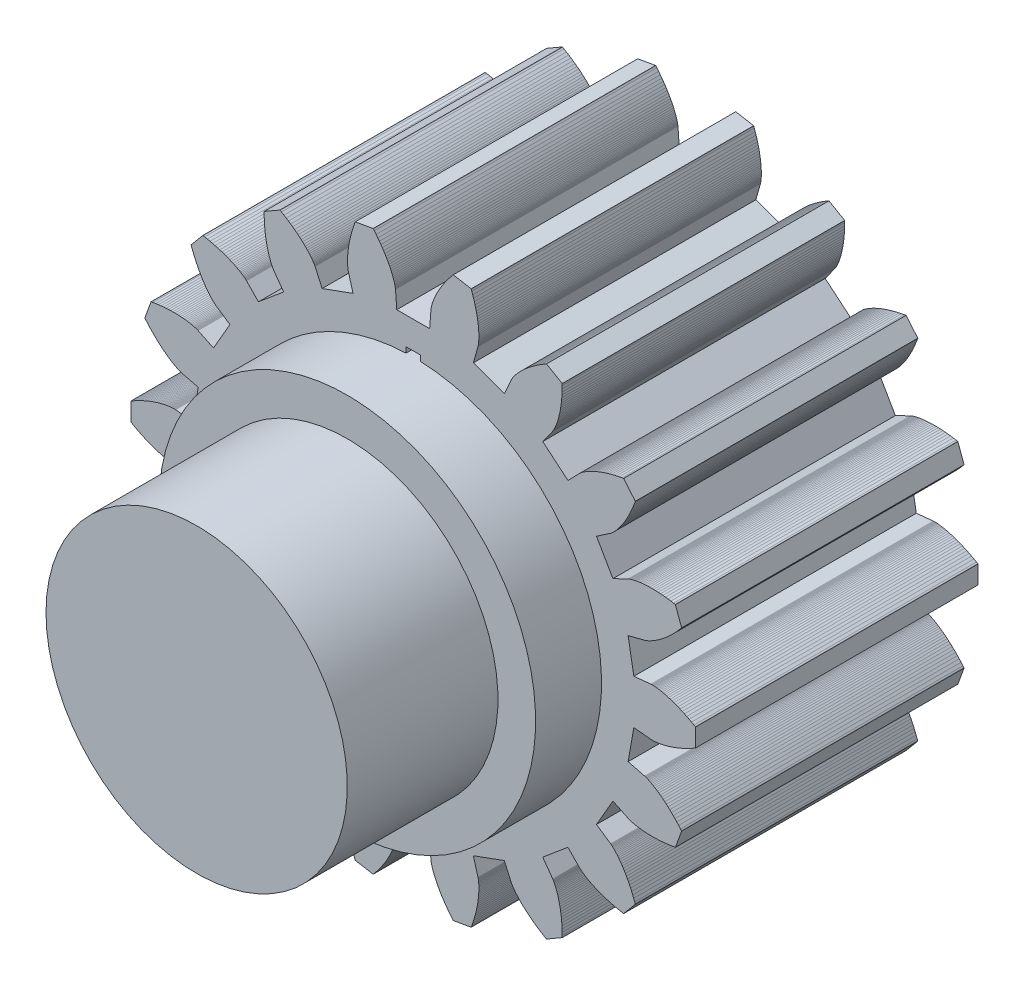
from build123d import *

# Parameters (mm, degrees)
EX_SUN_GEAR_PROFILE_DEPTH = 7.5
SKETCH1_W                 = 0.758517846
SKETCH1_H                 = 2.788377582
CUT_EXTRUDE1_DEPTH        = 1


with BuildPart() as part:
    # SK_Sun_Gear_Profile_DXF → EX_Sun_Gear_Profile (new, symmetric)
    with BuildSketch(Plane.XY):
        Polygon((11.715844, -1.1788231), (12.624043, -1.2701816), (12.6307047, -1.2706619), (12.6421382, -1.2712692), (12.6583493, -1.2718184), (12.6793382, -1.2721246), (12.7050997, -1.2720025), (12.7356234, -1.2712672), (12.7708933, -1.2697341), (12.8108882, -1.2672187), (12.8555814, -1.2635374), (12.9049411, -1.2585073), (12.9589299, -1.2519461), (13.0175052, -1.2436725), (13.0806192, -1.2335066), (13.1482187, -1.2212695), (13.2202453, -1.2067837), (13.2966355, -1.1898733), (13.3773206, -1.1703639), (13.4622268, -1.1480831), (13.5512752, -1.1228603), (13.6443819, -1.0945269), (13.7414581, -1.0629166), (13.84241, -1.0278654), (13.9471389, -0.9892116), (14.0555414, -0.9467962), (14.1675093, -0.9004628), (14.2829298, -0.850058), (14.4016854, -0.795431), (14.5236543, -0.7364343), (14.6487099, -0.6729237), (14.7767214, -0.6047579), (14.9075538, -0.5317993), (14.9739844, -0.4934806), (14.9906948, -0.4837065), (14.9917405, -0.483093), (14.9922286, 0.4827851), (14.9906948, 0.4837065), (14.9739844, 0.4934806), (14.9075538, 0.5317993), (14.7767214, 0.6047579), (14.6487099, 0.6729237), (14.5236543, 0.7364343), (14.4016854, 0.795431), (14.2829298, 0.850058), (14.1675093, 0.9004628), (14.0555414, 0.9467962), (13.9471389, 0.9892116), (13.84241, 1.0278654), (13.7414581, 1.0629166), (13.6443819, 1.0945269), (13.5512752, 1.1228603), (13.4622268, 1.1480831), (13.3773206, 1.1703639), (13.2966355, 1.1898733), (13.2202453, 1.2067837), (13.1482187, 1.2212695), (13.0806192, 1.2335066), (13.0175052, 1.2436725), (12.9589299, 1.2519461), (12.9049411, 1.2585073), (12.8555814, 1.2635374), (12.8108882, 1.2672187), (12.7708933, 1.2697341), (12.7356234, 1.2712672), (12.7050997, 1.2720025), (12.6793382, 1.2721246), (12.6583493, 1.2718184), (12.6421382, 1.2712692), (12.6307047, 1.2706619), (12.624043, 1.2701816), (11.715844, 1.1788231), (11.4124734, 2.8993233), (12.2971477, 3.1240968), (12.3035719, 3.1259238), (12.3145237, 3.1292637), (12.329945, 3.134292), (12.3497728, 3.141183), (12.3739389, 3.1501086), (12.4023703, 3.1612393), (12.4349888, 3.174743), (12.4717114, 3.1907858), (12.5124503, 3.209531), (12.5571128, 3.2311398), (12.6056016, 3.2557706), (12.6578147, 3.2835791), (12.7136455, 3.3147182), (12.7729828, 3.3493377), (12.8357113, 3.3875844), (12.9017109, 3.429602), (12.9708575, 3.4755308), (13.0430227, 3.5255075), (13.1180742, 3.5796656), (13.1958753, 3.6381346), (13.2762857, 3.7010406), (13.3591612, 3.7685055), (13.4443538, 3.8406476), (13.5317119, 3.9175809), (13.6210804, 3.9994153), (13.7123007, 4.0862565), (13.805211, 4.1782059), (13.8996461, 4.2753604), (13.995438, 4.3778124), (14.0924154, 4.4856499), (14.1904043, 4.5989559), (14.239723, 4.6576842), (14.2520826, 4.6725841), (14.2528555, 4.6735183), (13.9229644, 5.5813137), (13.9212079, 5.581655), (13.9021624, 5.5851244), (13.8266322, 5.5984115), (13.6787367, 5.6222229), (13.5351311, 5.6424952), (13.3958954, 5.6594042), (13.2611041, 5.6731271), (13.1308268, 5.6838429), (13.0051275, 5.6917318), (12.8840651, 5.6969757), (12.7676932, 5.6997573), (12.6560598, 5.7002606), (12.5492079, 5.6986704), (12.4471748, 5.6951723), (12.3499925, 5.6899526), (12.2576876, 5.683198), (12.1702814, 5.6750954), (12.0877896, 5.6658323), (12.0102226, 5.6555959), (11.9375853, 5.6445736), (11.8698772, 5.6329523), (11.8070926, 5.6209189), (11.7492201, 5.6086595), (11.6962431, 5.5963598), (11.6481398, 5.5842046), (11.6048828, 5.5723779), (11.5664396, 5.5610625), (11.5327723, 5.5504402), (11.503838, 5.5406914), (11.4795883, 5.5319952), (11.4599699, 5.5245289), (11.4449244, 5.5184682), (11.434388, 5.513987), (11.4282924, 5.5112572), (10.6061109, 5.114786), (9.7325901, 6.6277685), (10.4870349, 7.1415629), (10.4924468, 7.145477), (10.5015958, 7.1523611), (10.5143673, 7.1623607), (10.5306425, 7.1756175), (10.5502985, 7.1922702), (10.5732084, 7.2124537), (10.5992411, 7.2362992), (10.6282622, 7.2639344), (10.6601329, 7.2954826), (10.6947113, 7.3310637), (10.7318517, 7.3707933), (10.7714049, 7.4147826), (10.8132184, 7.463139), (10.8571368, 7.5159653), (10.9030011, 7.5733599), (10.9506495, 7.6354167), (10.9999175, 7.7022252), (11.0506376, 7.7738699), (11.1026398, 7.8504309), (11.1557513, 7.9319834), (11.2097973, 8.0185976), (11.2646004, 8.1103391), (11.3199812, 8.207268), (11.3757582, 8.3094399), (11.4317481, 8.4169049), (11.4877657, 8.5297081), (11.5436243, 8.6478895), (11.5991355, 8.7714836), (11.6541098, 8.9005198), (11.7083562, 9.035022), (11.7616827, 9.175009), (11.7879408, 9.2470636), (11.794459, 9.2652922), (11.7948657, 9.2664343), (11.1743852, 10.0066536), (11.1726179, 10.0063736), (11.1535344, 10.0031197), (11.0780148, 9.9897727), (10.9308945, 9.9615648), (10.7890158, 9.9314986), (10.6523938, 9.8997665), (10.5210379, 9.8665604), (10.3949523, 9.8320725), (10.2741354, 9.796494), (10.1585805, 9.7600158), (10.0482753, 9.7228281), (9.9432021, 9.6851202), (9.843338, 9.6470804), (9.7486546, 9.6088959), (9.6591184, 9.5707527), (9.5746904, 9.5328353), (9.4953267, 9.4953267), (9.4209779, 9.4584083), (9.3515898, 9.4222598), (9.2871029, 9.3870588), (9.2274529, 9.3529809), (9.1725703, 9.3201995), (9.1223808, 9.2888859), (9.0768056, 9.2592088), (9.0357605, 9.2313343), (8.9991572, 9.205426), (8.9669025, 9.1816447), (8.9388987, 9.1601481), (8.9150436, 9.1410912), (8.8952306, 9.1246255), (8.879349, 9.1108996), (8.8672837, 9.1000585), (8.8589154, 9.0922439), (8.854121, 9.0875939), (8.2171243, 8.4338303), (6.8788128, 9.556807), (7.412031, 10.2976511), (7.4157778, 10.3031802), (7.4220205, 10.3127783), (7.4306018, 10.3265429), (7.4413613, 10.3445667), (7.4541364, 10.3669379), (7.4687614, 10.3937398), (7.4850686, 10.425051), (7.5028877, 10.4609453), (7.5220462, 10.5014914), (7.5423698, 10.5467532), (7.563682, 10.5967895), (7.5858046, 10.651654), (7.6085577, 10.7113952), (7.6317598, 10.7760566), (7.655228, 10.8456764), (7.6787782, 10.9202875), (7.7022252, 10.9999175), (7.7253825, 11.0845888), (7.7480631, 11.1743184), (7.7700791, 11.2691179), (7.7912419, 11.3689935), (7.8113625, 11.473946), (7.8302518, 11.5839708), (7.8477202, 11.6990578), (7.8635783, 11.8191915), (7.8776367, 11.9443511), (7.8897062, 12.07451), (7.899598, 12.2096364), (7.9071239, 12.349693), (7.9120964, 12.4946372), (7.9143286, 12.6444207), (7.9143589, 12.7211106), (7.9142495, 12.7404692), (7.9142411, 12.7416816), (7.0780102, 13.2250434), (7.0764453, 13.2241758), (7.0596255, 13.2145912), (6.9932252, 13.1762199), (6.864625, 13.099395), (6.7415859, 13.0226167), (6.6240563, 12.9460707), (6.5119793, 12.8699409), (6.4052931, 12.794409), (6.303931, 12.7196544), (6.2078211, 12.645854), (6.1168871, 12.5731824), (6.0310474, 12.5018114), (5.9502163, 12.4319101), (5.8743029, 12.3636448), (5.8032121, 12.2971787), (5.7368443, 12.232672), (5.6750954, 12.1702814), (5.6178573, 12.1101608), (5.5650173, 12.0524601), (5.5164589, 11.9973261), (5.4720615, 11.9449019), (5.4317006, 11.8953265), (5.3952479, 11.8487355), (5.3625713, 11.8052605), (5.3335352, 11.7650288), (5.3080005, 11.728164), (5.2858247, 11.694785), (5.266862, 11.665007), (5.2509634, 11.6389404), (5.2379769, 11.6166913), (5.2277476, 11.5983613), (5.2201177, 11.5840475), (5.2149269, 11.573842), (5.212012, 11.5678327), (4.8370312, 10.7356301), (3.1953491, 11.3331535), (3.4430267, 12.2116907), (3.4446565, 12.2181678), (3.44724, 12.2293222), (3.450596, 12.2451916), (3.4545422, 12.2658085), (3.4588954, 12.2911998), (3.4634716, 12.3213874), (3.4680863, 12.3563877), (3.4725542, 12.3962118), (3.4766898, 12.4408653), (3.4803072, 12.4903486), (3.4832207, 12.5446565), (3.4852444, 12.6037786), (3.4861926, 12.667699), (3.4858799, 12.7363965), (3.4841215, 12.8098443), (3.4807329, 12.8880104), (3.4755308, 12.9708575), (3.4683323, 13.0583428), (3.4589558, 13.1504183), (3.4472206, 13.2470305), (3.4329477, 13.348121), (3.4159591, 13.4536257), (3.3960785, 13.5634757), (3.3731314, 13.6775967), (3.3469449, 13.7959093), (3.3173484, 13.918329), (3.284173, 14.0447663), (3.2472523, 14.1751269), (3.2064222, 14.3093111), (3.161521, 14.4472147), (3.1123896, 14.5887286), (3.0861886, 14.660804), (3.0794648, 14.6789577), (3.0790422, 14.6800941), (2.1279227, 14.8482977), (2.1267489, 14.8469472), (2.1142216, 14.832188), (2.0649495, 14.7734205), (1.9703805, 14.6572449), (1.8810213, 14.543015), (1.7967599, 14.4308878), (1.7174798, 14.3210166), (1.6430611, 14.213551), (1.5733794, 14.1086367), (1.5083069, 14.0064155), (1.447712, 13.9070253), (1.3914595, 13.8105996), (1.3394106, 13.717268), (1.2914235, 13.6271557), (1.2473527, 13.5403835), (1.20705, 13.4570679), (1.1703639, 13.3773206), (1.1371401, 13.301249), (1.1072215, 13.2289558), (1.0804485, 13.1605389), (1.0566588, 13.0960914), (1.0356877, 13.0357016), (1.0173684, 12.9794528), (1.0015318, 12.9274236), (0.9880068, 12.8796873), (0.9766206, 12.8363122), (0.9671984, 12.7973617), (0.959564, 12.7628939), (0.9535395, 12.7329616), (0.9489458, 12.7076127), (0.9456026, 12.6868895), (0.9433285, 12.6708293), (0.9419412, 12.659464), (0.9412574, 12.6528201), (0.8735208, 11.7425545), (-0.8735208, 11.7425545), (-0.9412574, 12.6528201), (-0.9419412, 12.659464), (-0.9433285, 12.6708293), (-0.9456026, 12.6868895), (-0.9489458, 12.7076127), (-0.9535395, 12.7329616), (-0.959564, 12.7628939), (-0.9671984, 12.7973617), (-0.9766206, 12.8363122), (-0.9880068, 12.8796873), (-1.0015318, 12.9274236), (-1.0173684, 12.9794528), (-1.0356877, 13.0357016), (-1.0566588, 13.0960914), (-1.0804485, 13.1605389), (-1.1072215, 13.2289558), (-1.1371401, 13.301249), (-1.1703639, 13.3773206), (-1.20705, 13.4570679), (-1.2473527, 13.5403835), (-1.2914235, 13.6271557), (-1.3394106, 13.717268), (-1.3914595, 13.8105996), (-1.447712, 13.9070253), (-1.5083069, 14.0064155), (-1.5733794, 14.1086367), (-1.6430611, 14.213551), (-1.7174798, 14.3210166), (-1.7967599, 14.4308878), (-1.8810213, 14.543015), (-1.9703805, 14.6572449), (-2.0649495, 14.7734205), (-2.1142216, 14.832188), (-2.1267489, 14.8469472), (-2.1275347, 14.8478705), (-3.0788237, 14.6806282), (-3.0794648, 14.6789577), (-3.0861886, 14.660804), (-3.1123896, 14.5887286), (-3.161521, 14.4472147), (-3.2064222, 14.3093111), (-3.2472523, 14.1751269), (-3.284173, 14.0447663), (-3.3173484, 13.918329), (-3.3469449, 13.7959093), (-3.3731314, 13.6775967), (-3.3960785, 13.5634757), (-3.4159591, 13.4536257), (-3.4329477, 13.348121), (-3.4472206, 13.2470305), (-3.4589558, 13.1504183), (-3.4683323, 13.0583428), (-3.4755308, 12.9708575), (-3.4807329, 12.8880104), (-3.4841215, 12.8098443), (-3.4858799, 12.7363965), (-3.4861926, 12.667699), (-3.4852444, 12.6037786), (-3.4832207, 12.5446565), (-3.4803072, 12.4903486), (-3.4766898, 12.4408653), (-3.4725542, 12.3962118), (-3.4680863, 12.3563877), (-3.4634716, 12.3213874), (-3.4588954, 12.2911998), (-3.4545422, 12.2658085), (-3.450596, 12.2451916), (-3.44724, 12.2293222), (-3.4446565, 12.2181678), (-3.4430267, 12.2116907), (-3.1953491, 11.3331535), (-4.8370312, 10.7356301), (-5.212012, 11.5678327), (-5.2149269, 11.573842), (-5.2201177, 11.5840475), (-5.2277476, 11.5983613), (-5.2379769, 11.6166913), (-5.2509634, 11.6389404), (-5.266862, 11.665007), (-5.2858247, 11.694785), (-5.3080005, 11.728164), (-5.3335352, 11.7650288), (-5.3625713, 11.8052605), (-5.3952479, 11.8487355), (-5.4317006, 11.8953265), (-5.4720615, 11.9449019), (-5.5164589, 11.9973261), (-5.5650173, 12.0524601), (-5.6178573, 12.1101608), (-5.6750954, 12.1702814), (-5.7368443, 12.232672), (-5.8032121, 12.2971787), (-5.8743029, 12.3636448), (-5.9502163, 12.4319101), (-6.0310474, 12.5018114), (-6.1168871, 12.5731824), (-6.2078211, 12.645854), (-6.303931, 12.7196544), (-6.4052931, 12.794409), (-6.5119793, 12.8699409), (-6.6240563, 12.9460707), (-6.7415859, 13.0226167), (-6.864625, 13.099395), (-6.9932252, 13.1762199), (-7.0596255, 13.2145912), (-7.0764453, 13.2241758), (-7.0774994, 13.2247747), (-7.9142184, 12.7422583), (-7.9142495, 12.7404692), (-7.9143589, 12.7211106), (-7.9143286, 12.6444207), (-7.9120964, 12.4946372), (-7.9071239, 12.349693), (-7.899598, 12.2096364), (-7.8897062, 12.07451), (-7.8776367, 11.9443511), (-7.8635783, 11.8191915), (-7.8477202, 11.6990578), (-7.8302518, 11.5839708), (-7.8113625, 11.473946), (-7.7912419, 11.3689935), (-7.7700791, 11.2691179), (-7.7480631, 11.1743184), (-7.7253825, 11.0845888), (-7.7022252, 10.9999175), (-7.6787782, 10.9202875), (-7.655228, 10.8456764), (-7.6317598, 10.7760566), (-7.6085577, 10.7113952), (-7.5858046, 10.651654), (-7.563682, 10.5967895), (-7.5423698, 10.5467532), (-7.5220462, 10.5014914), (-7.5028877, 10.4609453), (-7.4850686, 10.425051), (-7.4687614, 10.3937398), (-7.4541364, 10.3669379), (-7.4413613, 10.3445667), (-7.4306018, 10.3265429), (-7.4220205, 10.3127783), (-7.4157778, 10.3031802), (-7.412031, 10.2976511), (-6.8788128, 9.556807), (-8.2171243, 8.4338303), (-8.854121, 9.0875939), (-8.8589154, 9.0922439), (-8.8672837, 9.1000585), (-8.879349, 9.1108996), (-8.8952306, 9.1246255), (-8.9150436, 9.1410912), (-8.9388987, 9.1601481), (-8.9669025, 9.1816447), (-8.9991572, 9.205426), (-9.0357605, 9.2313343), (-9.0768056, 9.2592088), (-9.1223808, 9.2888859), (-9.1725703, 9.3201995), (-9.2274529, 9.3529809), (-9.2871029, 9.3870588), (-9.3515898, 9.4222598), (-9.4209779, 9.4584083), (-9.4953267, 9.4953267), (-9.5746904, 9.5328353), (-9.6591184, 9.5707527), (-9.7486546, 9.6088959), (-9.843338, 9.6470804), (-9.9432021, 9.6851202), (-10.0482753, 9.7228281), (-10.1585805, 9.7600158), (-10.2741354, 9.796494), (-10.3949523, 9.8320725), (-10.5210379, 9.8665604), (-10.6523938, 9.8997665), (-10.7890158, 9.9314986), (-10.9308945, 9.9615648), (-11.0780148, 9.9897727), (-11.1535344, 10.0031197), (-11.1726179, 10.0063736), (-11.1738133, 10.0065758), (-11.7950417, 9.266984), (-11.794459, 9.2652922), (-11.7879408, 9.2470636), (-11.7616827, 9.175009), (-11.7083562, 9.035022), (-11.6541098, 8.9005198), (-11.5991355, 8.7714836), (-11.5436243, 8.6478895), (-11.4877657, 8.5297081), (-11.4317481, 8.4169049), (-11.3757582, 8.3094399), (-11.3199812, 8.207268), (-11.2646004, 8.1103391), (-11.2097973, 8.0185976), (-11.1557513, 7.9319834), (-11.1026398, 7.8504309), (-11.0506376, 7.7738699), (-10.9999175, 7.7022252), (-10.9506495, 7.6354167), (-10.9030011, 7.5733599), (-10.8571368, 7.5159653), (-10.8132184, 7.463139), (-10.7714049, 7.4147826), (-10.7318517, 7.3707933), (-10.6947113, 7.3310637), (-10.6601329, 7.2954826), (-10.6282622, 7.2639344), (-10.5992411, 7.2362992), (-10.5732084, 7.2124537), (-10.5502985, 7.1922702), (-10.5306425, 7.1756175), (-10.5143673, 7.1623607), (-10.5015958, 7.1523611), (-10.4924468, 7.145477), (-10.4870349, 7.1415629), (-9.7325901, 6.6277685), (-10.6061109, 5.114786), (-11.4282924, 5.5112572), (-11.434388, 5.513987), (-11.4449244, 5.5184682), (-11.4599699, 5.5245289), (-11.4795883, 5.5319952), (-11.503838, 5.5406914), (-11.5327723, 5.5504402), (-11.5664396, 5.5610625), (-11.6048828, 5.5723779), (-11.6481398, 5.5842046), (-11.6962431, 5.5963598), (-11.7492201, 5.6086595), (-11.8070926, 5.6209189), (-11.8698772, 5.6329523), (-11.9375853, 5.6445736), (-12.0102226, 5.6555959), (-12.0877896, 5.6658323), (-12.1702814, 5.6750954), (-12.2576876, 5.683198), (-12.3499925, 5.6899526), (-12.4471748, 5.6951723), (-12.5492079, 5.6986704), (-12.6560598, 5.7002606), (-12.7676932, 5.6997573), (-12.8840651, 5.6969757), (-13.0051275, 5.6917318), (-13.1308268, 5.6838429), (-13.2611041, 5.6731271), (-13.3958954, 5.6594042), (-13.5351311, 5.6424952), (-13.6787367, 5.6222229), (-13.8266322, 5.5984115), (-13.9021624, 5.5851244), (-13.9212079, 5.581655), (-13.9224004, 5.5814362), (-14.2532088, 4.6739746), (-14.2520826, 4.6725841), (-14.239723, 4.6576842), (-14.1904043, 4.5989559), (-14.0924154, 4.4856499), (-13.995438, 4.3778124), (-13.8996461, 4.2753604), (-13.805211, 4.1782059), (-13.7123007, 4.0862565), (-13.6210804, 3.9994153), (-13.5317119, 3.9175809), (-13.4443538, 3.8406476), (-13.3591612, 3.7685055), (-13.2762857, 3.7010406), (-13.1958753, 3.6381346), (-13.1180742, 3.5796656), (-13.0430227, 3.5255075), (-12.9708575, 3.4755308), (-12.9017109, 3.429602), (-12.8357113, 3.3875844), (-12.7729828, 3.3493377), (-12.7136455, 3.3147182), (-12.6578147, 3.2835791), (-12.6056016, 3.2557706), (-12.5571128, 3.2311398), (-12.5124503, 3.209531), (-12.4717114, 3.1907858), (-12.4349888, 3.174743), (-12.4023703, 3.1612393), (-12.3739389, 3.1501086), (-12.3497728, 3.141183), (-12.329945, 3.134292), (-12.3145237, 3.1292637), (-12.3035719, 3.1259238), (-12.2971477, 3.1240968), (-11.4124734, 2.8993233), (-11.715844, 1.1788231), (-12.624043, 1.2701816), (-12.6307047, 1.2706619), (-12.6421382, 1.2712692), (-12.6583493, 1.2718184), (-12.6793382, 1.2721246), (-12.7050997, 1.2720025), (-12.7356234, 1.2712672), (-12.7708933, 1.2697341), (-12.8108882, 1.2672187), (-12.8555814, 1.2635374), (-12.9049411, 1.2585073), (-12.9589299, 1.2519461), (-13.0175052, 1.2436725), (-13.0806192, 1.2335066), (-13.1482187, 1.2212695), (-13.2202453, 1.2067837), (-13.2966355, 1.1898733), (-13.3773206, 1.1703639), (-13.4622268, 1.1480831), (-13.5512752, 1.1228603), (-13.6443819, 1.0945269), (-13.7414581, 1.0629166), (-13.84241, 1.0278654), (-13.9471389, 0.9892116), (-14.0555414, 0.9467962), (-14.1675093, 0.9004628), (-14.2829298, 0.850058), (-14.4016854, 0.795431), (-14.5236543, 0.7364343), (-14.6487099, 0.6729237), (-14.7767214, 0.6047579), (-14.9075538, 0.5317993), (-14.9739844, 0.4934806), (-14.9906948, 0.4837065), (-14.9917405, 0.483093), (-14.9922286, -0.4827851), (-14.9906948, -0.4837065), (-14.9739844, -0.4934806), (-14.9075538, -0.5317993), (-14.7767214, -0.6047579), (-14.6487099, -0.6729237), (-14.5236543, -0.7364343), (-14.4016854, -0.795431), (-14.2829298, -0.850058), (-14.1675093, -0.9004628), (-14.0555414, -0.9467962), (-13.9471389, -0.9892116), (-13.84241, -1.0278654), (-13.7414581, -1.0629166), (-13.6443819, -1.0945269), (-13.5512752, -1.1228603), (-13.4622268, -1.1480831), (-13.3773206, -1.1703639), (-13.2966355, -1.1898733), (-13.2202453, -1.2067837), (-13.1482187, -1.2212695), (-13.0806192, -1.2335066), (-13.0175052, -1.2436725), (-12.9589299, -1.2519461), (-12.9049411, -1.2585073), (-12.8555814, -1.2635374), (-12.8108882, -1.2672187), (-12.7708933, -1.2697341), (-12.7356234, -1.2712672), (-12.7050997, -1.2720025), (-12.6793382, -1.2721246), (-12.6583493, -1.2718184), (-12.6421382, -1.2712692), (-12.6307047, -1.2706619), (-12.624043, -1.2701816), (-11.715844, -1.1788231), (-11.4124734, -2.8993233), (-12.2971477, -3.1240968), (-12.3035719, -3.1259238), (-12.3145237, -3.1292637), (-12.329945, -3.134292), (-12.3497728, -3.141183), (-12.3739389, -3.1501086), (-12.4023703, -3.1612393), (-12.4349888, -3.174743), (-12.4717114, -3.1907858), (-12.5124503, -3.209531), (-12.5571128, -3.2311398), (-12.6056016, -3.2557706), (-12.6578147, -3.2835791), (-12.7136455, -3.3147182), (-12.7729828, -3.3493377), (-12.8357113, -3.3875844), (-12.9017109, -3.429602), (-12.9708575, -3.4755308), (-13.0430227, -3.5255075), (-13.1180742, -3.5796656), (-13.1958753, -3.6381346), (-13.2762857, -3.7010406), (-13.3591612, -3.7685055), (-13.4443538, -3.8406476), (-13.5317119, -3.9175809), (-13.6210804, -3.9994153), (-13.7123007, -4.0862565), (-13.805211, -4.1782059), (-13.8996461, -4.2753604), (-13.995438, -4.3778124), (-14.0924154, -4.4856499), (-14.1904043, -4.5989559), (-14.239723, -4.6576842), (-14.2520826, -4.6725841), (-14.2528555, -4.6735183), (-13.9229644, -5.5813137), (-13.9212079, -5.581655), (-13.9021624, -5.5851244), (-13.8266322, -5.5984115), (-13.6787367, -5.6222229), (-13.5351311, -5.6424952), (-13.3958954, -5.6594042), (-13.2611041, -5.6731271), (-13.1308268, -5.6838429), (-13.0051275, -5.6917318), (-12.8840651, -5.6969757), (-12.7676932, -5.6997573), (-12.6560598, -5.7002606), (-12.5492079, -5.6986704), (-12.4471748, -5.6951723), (-12.3499925, -5.6899526), (-12.2576876, -5.683198), (-12.1702814, -5.6750954), (-12.0877896, -5.6658323), (-12.0102226, -5.6555959), (-11.9375853, -5.6445736), (-11.8698772, -5.6329523), (-11.8070926, -5.6209189), (-11.7492201, -5.6086595), (-11.6962431, -5.5963598), (-11.6481398, -5.5842046), (-11.6048828, -5.5723779), (-11.5664396, -5.5610625), (-11.5327723, -5.5504402), (-11.503838, -5.5406914), (-11.4795883, -5.5319952), (-11.4599699, -5.5245289), (-11.4449244, -5.5184682), (-11.434388, -5.513987), (-11.4282924, -5.5112572), (-10.6061109, -5.114786), (-9.7325901, -6.6277685), (-10.4870349, -7.1415629), (-10.4924468, -7.145477), (-10.5015958, -7.1523611), (-10.5143673, -7.1623607), (-10.5306425, -7.1756175), (-10.5502985, -7.1922702), (-10.5732084, -7.2124537), (-10.5992411, -7.2362992), (-10.6282622, -7.2639344), (-10.6601329, -7.2954826), (-10.6947113, -7.3310637), (-10.7318517, -7.3707933), (-10.7714049, -7.4147826), (-10.8132184, -7.463139), (-10.8571368, -7.5159653), (-10.9030011, -7.5733599), (-10.9506495, -7.6354167), (-10.9999175, -7.7022252), (-11.0506376, -7.7738699), (-11.1026398, -7.8504309), (-11.1557513, -7.9319834), (-11.2097973, -8.0185976), (-11.2646004, -8.1103391), (-11.3199812, -8.207268), (-11.3757582, -8.3094399), (-11.4317481, -8.4169049), (-11.4877657, -8.5297081), (-11.5436243, -8.6478895), (-11.5991355, -8.7714836), (-11.6541098, -8.9005198), (-11.7083562, -9.035022), (-11.7616827, -9.175009), (-11.7879408, -9.2470636), (-11.794459, -9.2652922), (-11.7948657, -9.2664343), (-11.1743852, -10.0066536), (-11.1726179, -10.0063736), (-11.1535344, -10.0031197), (-11.0780148, -9.9897727), (-10.9308945, -9.9615648), (-10.7890158, -9.9314986), (-10.6523938, -9.8997665), (-10.5210379, -9.8665604), (-10.3949523, -9.8320725), (-10.2741354, -9.796494), (-10.1585805, -9.7600158), (-10.0482753, -9.7228281), (-9.9432021, -9.6851202), (-9.843338, -9.6470804), (-9.7486546, -9.6088959), (-9.6591184, -9.5707527), (-9.5746904, -9.5328353), (-9.4953267, -9.4953267), (-9.4209779, -9.4584083), (-9.3515898, -9.4222598), (-9.2871029, -9.3870588), (-9.2274529, -9.3529809), (-9.1725703, -9.3201995), (-9.1223808, -9.2888859), (-9.0768056, -9.2592088), (-9.0357605, -9.2313343), (-8.9991572, -9.205426), (-8.9669025, -9.1816447), (-8.9388987, -9.1601481), (-8.9150436, -9.1410912), (-8.8952306, -9.1246255), (-8.879349, -9.1108996), (-8.8672837, -9.1000585), (-8.8589154, -9.0922439), (-8.854121, -9.0875939), (-8.2171243, -8.4338303), (-6.8788128, -9.556807), (-7.412031, -10.2976511), (-7.4157778, -10.3031802), (-7.4220205, -10.3127783), (-7.4306018, -10.3265429), (-7.4413613, -10.3445667), (-7.4541364, -10.3669379), (-7.4687614, -10.3937398), (-7.4850686, -10.425051), (-7.5028877, -10.4609453), (-7.5220462, -10.5014914), (-7.5423698, -10.5467532), (-7.563682, -10.5967895), (-7.5858046, -10.651654), (-7.6085577, -10.7113952), (-7.6317598, -10.7760566), (-7.655228, -10.8456764), (-7.6787782, -10.9202875), (-7.7022252, -10.9999175), (-7.7253825, -11.0845888), (-7.7480631, -11.1743184), (-7.7700791, -11.2691179), (-7.7912419, -11.3689935), (-7.8113625, -11.473946), (-7.8302518, -11.5839708), (-7.8477202, -11.6990578), (-7.8635783, -11.8191915), (-7.8776367, -11.9443511), (-7.8897062, -12.07451), (-7.899598, -12.2096364), (-7.9071239, -12.349693), (-7.9120964, -12.4946372), (-7.9143286, -12.6444207), (-7.9143589, -12.7211106), (-7.9142495, -12.7404692), (-7.9142411, -12.7416816), (-7.0780102, -13.2250434), (-7.0764453, -13.2241758), (-7.0596255, -13.2145912), (-6.9932252, -13.1762199), (-6.864625, -13.099395), (-6.7415859, -13.0226167), (-6.6240563, -12.9460707), (-6.5119793, -12.8699409), (-6.4052931, -12.794409), (-6.303931, -12.7196544), (-6.2078211, -12.645854), (-6.1168871, -12.5731824), (-6.0310474, -12.5018114), (-5.9502163, -12.4319101), (-5.8743029, -12.3636448), (-5.8032121, -12.2971787), (-5.7368443, -12.232672), (-5.6750954, -12.1702814), (-5.6178573, -12.1101608), (-5.5650173, -12.0524601), (-5.5164589, -11.9973261), (-5.4720615, -11.9449019), (-5.4317006, -11.8953265), (-5.3952479, -11.8487355), (-5.3625713, -11.8052605), (-5.3335352, -11.7650288), (-5.3080005, -11.728164), (-5.2858247, -11.694785), (-5.266862, -11.665007), (-5.2509634, -11.6389404), (-5.2379769, -11.6166913), (-5.2277476, -11.5983613), (-5.2201177, -11.5840475), (-5.2149269, -11.573842), (-5.212012, -11.5678327), (-4.8370312, -10.7356301), (-3.1953491, -11.3331535), (-3.4430267, -12.2116907), (-3.4446565, -12.2181678), (-3.44724, -12.2293222), (-3.450596, -12.2451916), (-3.4545422, -12.2658085), (-3.4588954, -12.2911998), (-3.4634716, -12.3213874), (-3.4680863, -12.3563877), (-3.4725542, -12.3962118), (-3.4766898, -12.4408653), (-3.4803072, -12.4903486), (-3.4832207, -12.5446565), (-3.4852444, -12.6037786), (-3.4861926, -12.667699), (-3.4858799, -12.7363965), (-3.4841215, -12.8098443), (-3.4807329, -12.8880104), (-3.4755308, -12.9708575), (-3.4683323, -13.0583428), (-3.4589558, -13.1504183), (-3.4472206, -13.2470305), (-3.4329477, -13.348121), (-3.4159591, -13.4536257), (-3.3960785, -13.5634757), (-3.3731314, -13.6775967), (-3.3469449, -13.7959093), (-3.3173484, -13.918329), (-3.284173, -14.0447663), (-3.2472523, -14.1751269), (-3.2064222, -14.3093111), (-3.161521, -14.4472147), (-3.1123896, -14.5887286), (-3.0861886, -14.660804), (-3.0794648, -14.6789577), (-3.0790422, -14.6800941), (-2.1279227, -14.8482977), (-2.1267489, -14.8469472), (-2.1142216, -14.832188), (-2.0649495, -14.7734205), (-1.9703805, -14.6572449), (-1.8810213, -14.543015), (-1.7967599, -14.4308878), (-1.7174798, -14.3210166), (-1.6430611, -14.213551), (-1.5733794, -14.1086367), (-1.5083069, -14.0064155), (-1.447712, -13.9070253), (-1.3914595, -13.8105996), (-1.3394106, -13.717268), (-1.2914235, -13.6271557), (-1.2473527, -13.5403835), (-1.20705, -13.4570679), (-1.1703639, -13.3773206), (-1.1371401, -13.301249), (-1.1072215, -13.2289558), (-1.0804485, -13.1605389), (-1.0566588, -13.0960914), (-1.0356877, -13.0357016), (-1.0173684, -12.9794528), (-1.0015318, -12.9274236), (-0.9880068, -12.8796873), (-0.9766206, -12.8363122), (-0.9671984, -12.7973617), (-0.959564, -12.7628939), (-0.9535395, -12.7329616), (-0.9489458, -12.7076127), (-0.9456026, -12.6868895), (-0.9433285, -12.6708293), (-0.9419412, -12.659464), (-0.9412574, -12.6528201), (-0.8735208, -11.7425545), (0.8735208, -11.7425545), (0.9412574, -12.6528201), (0.9419412, -12.659464), (0.9433285, -12.6708293), (0.9456026, -12.6868895), (0.9489458, -12.7076127), (0.9535395, -12.7329616), (0.959564, -12.7628939), (0.9671984, -12.7973617), (0.9766206, -12.8363122), (0.9880068, -12.8796873), (1.0015318, -12.9274236), (1.0173684, -12.9794528), (1.0356877, -13.0357016), (1.0566588, -13.0960914), (1.0804485, -13.1605389), (1.1072215, -13.2289558), (1.1371401, -13.301249), (1.1703639, -13.3773206), (1.20705, -13.4570679), (1.2473527, -13.5403835), (1.2914235, -13.6271557), (1.3394106, -13.717268), (1.3914595, -13.8105996), (1.447712, -13.9070253), (1.5083069, -14.0064155), (1.5733794, -14.1086367), (1.6430611, -14.213551), (1.7174798, -14.3210166), (1.7967599, -14.4308878), (1.8810213, -14.543015), (1.9703805, -14.6572449), (2.0649495, -14.7734205), (2.1142216, -14.832188), (2.1267489, -14.8469472), (2.1275347, -14.8478705), (3.0788237, -14.6806282), (3.0794648, -14.6789577), (3.0861886, -14.660804), (3.1123896, -14.5887286), (3.161521, -14.4472147), (3.2064222, -14.3093111), (3.2472523, -14.1751269), (3.284173, -14.0447663), (3.3173484, -13.918329), (3.3469449, -13.7959093), (3.3731314, -13.6775967), (3.3960785, -13.5634757), (3.4159591, -13.4536257), (3.4329477, -13.348121), (3.4472206, -13.2470305), (3.4589558, -13.1504183), (3.4683323, -13.0583428), (3.4755308, -12.9708575), (3.4807329, -12.8880104), (3.4841215, -12.8098443), (3.4858799, -12.7363965), (3.4861926, -12.667699), (3.4852444, -12.6037786), (3.4832207, -12.5446565), (3.4803072, -12.4903486), (3.4766898, -12.4408653), (3.4725542, -12.3962118), (3.4680863, -12.3563877), (3.4634716, -12.3213874), (3.4588954, -12.2911998), (3.4545422, -12.2658085), (3.450596, -12.2451916), (3.44724, -12.2293222), (3.4446565, -12.2181678), (3.4430267, -12.2116907), (3.1953491, -11.3331535), (4.8370312, -10.7356301), (5.212012, -11.5678327), (5.2149269, -11.573842), (5.2201177, -11.5840475), (5.2277476, -11.5983613), (5.2379769, -11.6166913), (5.2509634, -11.6389404), (5.266862, -11.665007), (5.2858247, -11.694785), (5.3080005, -11.728164), (5.3335352, -11.7650288), (5.3625713, -11.8052605), (5.3952479, -11.8487355), (5.4317006, -11.8953265), (5.4720615, -11.9449019), (5.5164589, -11.9973261), (5.5650173, -12.0524601), (5.6178573, -12.1101608), (5.6750954, -12.1702814), (5.7368443, -12.232672), (5.8032121, -12.2971787), (5.8743029, -12.3636448), (5.9502163, -12.4319101), (6.0310474, -12.5018114), (6.1168871, -12.5731824), (6.2078211, -12.645854), (6.303931, -12.7196544), (6.4052931, -12.794409), (6.5119793, -12.8699409), (6.6240563, -12.9460707), (6.7415859, -13.0226167), (6.864625, -13.099395), (6.9932252, -13.1762199), (7.0596255, -13.2145912), (7.0764453, -13.2241758), (7.0774994, -13.2247747), (7.9142184, -12.7422583), (7.9142495, -12.7404692), (7.9143589, -12.7211106), (7.9143286, -12.6444207), (7.9120964, -12.4946372), (7.9071239, -12.349693), (7.899598, -12.2096364), (7.8897062, -12.07451), (7.8776367, -11.9443511), (7.8635783, -11.8191915), (7.8477202, -11.6990578), (7.8302518, -11.5839708), (7.8113625, -11.473946), (7.7912419, -11.3689935), (7.7700791, -11.2691179), (7.7480631, -11.1743184), (7.7253825, -11.0845888), (7.7022252, -10.9999175), (7.6787782, -10.9202875), (7.655228, -10.8456764), (7.6317598, -10.7760566), (7.6085577, -10.7113952), (7.5858046, -10.651654), (7.563682, -10.5967895), (7.5423698, -10.5467532), (7.5220462, -10.5014914), (7.5028877, -10.4609453), (7.4850686, -10.425051), (7.4687614, -10.3937398), (7.4541364, -10.3669379), (7.4413613, -10.3445667), (7.4306018, -10.3265429), (7.4220205, -10.3127783), (7.4157778, -10.3031802), (7.412031, -10.2976511), (6.8788128, -9.556807), (8.2171243, -8.4338303), (8.854121, -9.0875939), (8.8589154, -9.0922439), (8.8672837, -9.1000585), (8.879349, -9.1108996), (8.8952306, -9.1246255), (8.9150436, -9.1410912), (8.9388987, -9.1601481), (8.9669025, -9.1816447), (8.9991572, -9.205426), (9.0357605, -9.2313343), (9.0768056, -9.2592088), (9.1223808, -9.2888859), (9.1725703, -9.3201995), (9.2274529, -9.3529809), (9.2871029, -9.3870588), (9.3515898, -9.4222598), (9.4209779, -9.4584083), (9.4953267, -9.4953267), (9.5746904, -9.5328353), (9.6591184, -9.5707527), (9.7486546, -9.6088959), (9.843338, -9.6470804), (9.9432021, -9.6851202), (10.0482753, -9.7228281), (10.1585805, -9.7600158), (10.2741354, -9.796494), (10.3949523, -9.8320725), (10.5210379, -9.8665604), (10.6523938, -9.8997665), (10.7890158, -9.9314986), (10.9308945, -9.9615648), (11.0780148, -9.9897727), (11.1535344, -10.0031197), (11.1726179, -10.0063736), (11.1738133, -10.0065758), (11.7950417, -9.266984), (11.794459, -9.2652922), (11.7879408, -9.2470636), (11.7616827, -9.175009), (11.7083562, -9.035022), (11.6541098, -8.9005198), (11.5991355, -8.7714836), (11.5436243, -8.6478895), (11.4877657, -8.5297081), (11.4317481, -8.4169049), (11.3757582, -8.3094399), (11.3199812, -8.207268), (11.2646004, -8.1103391), (11.2097973, -8.0185976), (11.1557513, -7.9319834), (11.1026398, -7.8504309), (11.0506376, -7.7738699), (10.9999175, -7.7022252), (10.9506495, -7.6354167), (10.9030011, -7.5733599), (10.8571368, -7.5159653), (10.8132184, -7.463139), (10.7714049, -7.4147826), (10.7318517, -7.3707933), (10.6947113, -7.3310637), (10.6601329, -7.2954826), (10.6282622, -7.2639344), (10.5992411, -7.2362992), (10.5732084, -7.2124537), (10.5502985, -7.1922702), (10.5306425, -7.1756175), (10.5143673, -7.1623607), (10.5015958, -7.1523611), (10.4924468, -7.145477), (10.4870349, -7.1415629), (9.7325901, -6.6277685), (10.6061109, -5.114786), (11.4282924, -5.5112572), (11.434388, -5.513987), (11.4449244, -5.5184682), (11.4599699, -5.5245289), (11.4795883, -5.5319952), (11.503838, -5.5406914), (11.5327723, -5.5504402), (11.5664396, -5.5610625), (11.6048828, -5.5723779), (11.6481398, -5.5842046), (11.6962431, -5.5963598), (11.7492201, -5.6086595), (11.8070926, -5.6209189), (11.8698772, -5.6329523), (11.9375853, -5.6445736), (12.0102226, -5.6555959), (12.0877896, -5.6658323), (12.1702814, -5.6750954), (12.2576876, -5.683198), (12.3499925, -5.6899526), (12.4471748, -5.6951723), (12.5492079, -5.6986704), (12.6560598, -5.7002606), (12.7676932, -5.6997573), (12.8840651, -5.6969757), (13.0051275, -5.6917318), (13.1308268, -5.6838429), (13.2611041, -5.6731271), (13.3958954, -5.6594042), (13.5351311, -5.6424952), (13.6787367, -5.6222229), (13.8266322, -5.5984115), (13.9021624, -5.5851244), (13.9212079, -5.581655), (13.9224004, -5.5814362), (14.2532088, -4.6739746), (14.2520826, -4.6725841), (14.239723, -4.6576842), (14.1904043, -4.5989559), (14.0924154, -4.4856499), (13.995438, -4.3778124), (13.8996461, -4.2753604), (13.805211, -4.1782059), (13.7123007, -4.0862565), (13.6210804, -3.9994153), (13.5317119, -3.9175809), (13.4443538, -3.8406476), (13.3591612, -3.7685055), (13.2762857, -3.7010406), (13.1958753, -3.6381346), (13.1180742, -3.5796656), (13.0430227, -3.5255075), (12.9708575, -3.4755308), (12.9017109, -3.429602), (12.8357113, -3.3875844), (12.7729828, -3.3493377), (12.7136455, -3.3147182), (12.6578147, -3.2835791), (12.6056016, -3.2557706), (12.5571128, -3.2311398), (12.5124503, -3.209531), (12.4717114, -3.1907858), (12.4349888, -3.174743), (12.4023703, -3.1612393), (12.3739389, -3.1501086), (12.3497728, -3.141183), (12.329945, -3.134292), (12.3145237, -3.1292637), (12.3035719, -3.1259238), (12.2971477, -3.1240968), (11.4124734, -2.8993233), align=None)
    extrude(amount=EX_SUN_GEAR_PROFILE_DEPTH, both=True)

    # Sketch1 → Cut-Extrude1 (cut)
    with BuildSketch(Plane.XY.offset(7.5)):
        with Locations((0, 8.893234561)):
            Rectangle(SKETCH1_W, SKETCH1_H)
    cut_extrude1 = extrude(amount=-CUT_EXTRUDE1_DEPTH, mode=Mode.SUBTRACT)

    # Mirror1: Cut-Extrude1 across plane
    add(cut_extrude1.mirror(Plane.XY), mode=Mode.SUBTRACT)

    # Sketch2 → Revolve1 (revolve)
    with BuildSketch(Plane(origin=(0, 0, 0), x_dir=(0, 0, -1), z_dir=(1, 0, 0))):
        Polygon((-7, 0), (-7, 10), (-11, 10), (-11, 8), (-19, 8), (-19, 0), align=None)
    revolve(axis=Axis((0, 0, 0), (0, 0, 1)))


solid = part.part
